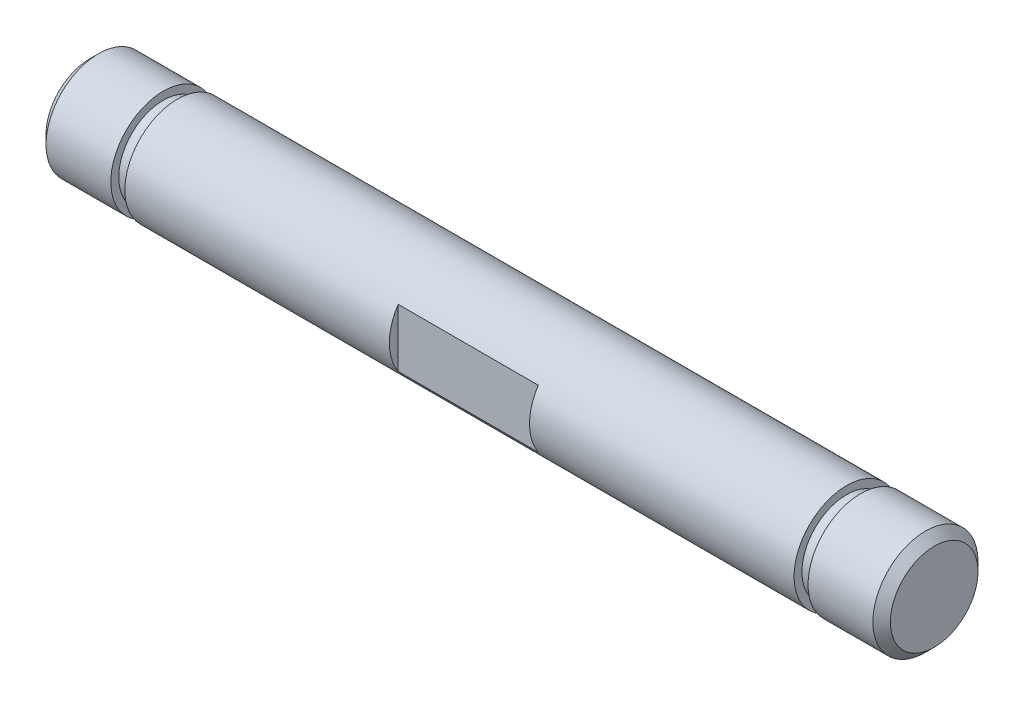
from build123d import *

# Parameters (mm, degrees)
CORTAR_EXTRUIR1_DEPTH = 4
CHAFL_N1_SIZE         = 0.5


with BuildPart() as part:
    # Croquis1 → Revolución1 (revolve)
    with BuildSketch(Plane(origin=(0, 0, 0), x_dir=(-1, 0, 0), z_dir=(0, 1, 0))):
        Polygon((-19.1, 3), (19.1, 3), (19.1, 2.55), (19.9, 2.55), (19.9, 3), (24.1, 3), (24.1, 0), (-24.1, 0), (-24.1, 3), (-19.9, 3), (-19.9, 2.55), (-19.1, 2.55), align=None)
    revolve(axis=Axis((24.1, 0, 0), (-1, 0, 0)))

    # Croquis2 → Cortar-Extruir1 (cut, symmetric)
    with BuildSketch(Plane.YZ):
        with BuildLine():
            Line((1.658312395, 2.5), (-1.658312395, 2.5))
            ThreePointArc((-1.658312395, 2.5), (0, 3), (1.658312395, 2.5))
        make_face()
    extrude(amount=CORTAR_EXTRUIR1_DEPTH, both=True, mode=Mode.SUBTRACT)

    # Chaflán1
    chafl_n1_edges = [part.edges().sort_by_distance(p)[0] for p in [
        (-24.1, 0, -3),
        (24.1, 0, -3),
    ]]
    chamfer(chafl_n1_edges, length=CHAFL_N1_SIZE)


solid = part.part
